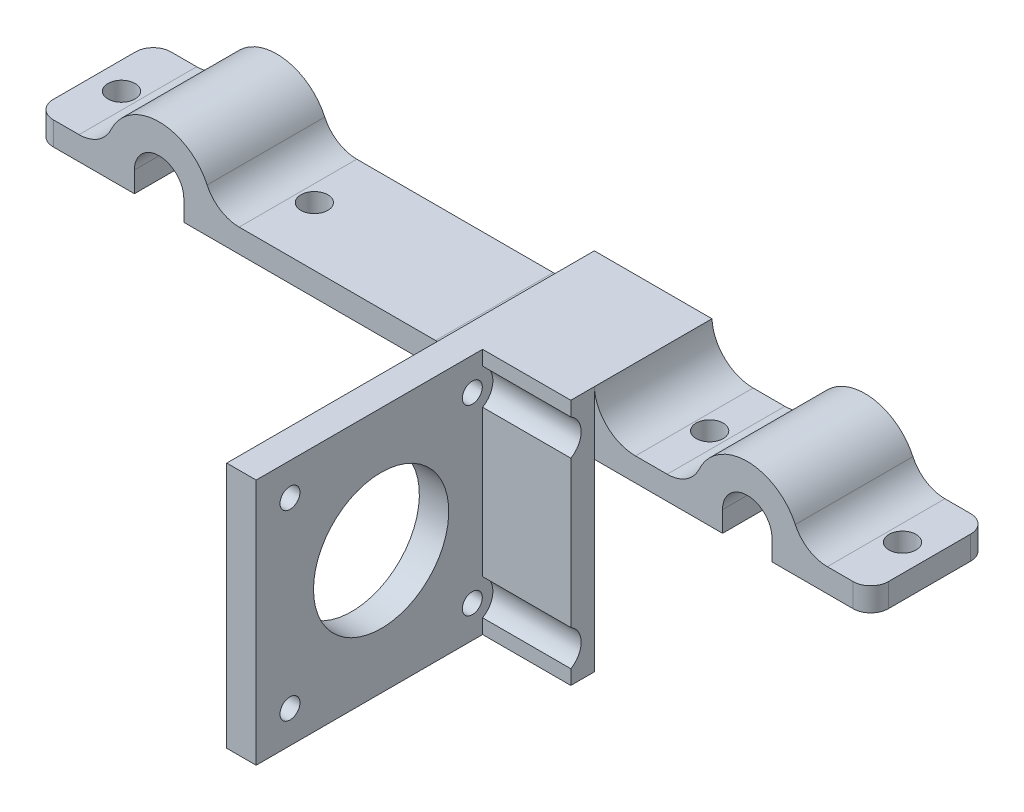
from build123d import *

# Parameters (mm, degrees)
EXTRUDE_1_DEPTH          = 20
FILLET_1_R               = 3
CUT_EXTRUDE_1_DEPTH      = 75.269642706
CUT_EXTRUDE_1_DEPTH_BACK = 75.269642706
SKETCH_2_R               = 2.3
SKETCH_3_W               = 20
SKETCH_3_H               = 35.3
EXTRUDE_2_DEPTH          = 4
SKETCH_4_W               = 5
SKETCH_4_H               = 42
EXTRUDE_3_DEPTH          = 38.5
EXTRUDE_4_DEPTH          = 6.7
CUT_EXTRUDE_2_REACH      = 119.861
SKETCH_6_R               = 11.5
SKETCH_6_R_2             = 1.7
FILLET_2_R               = 7
CUT_EXTRUDE_3_REACH      = 108.144
SKETCH_9_R               = 3.5
SKETCH_10_W              = 11.60500139
SKETCH_10_H              = 6
EXTRUDE_6_DEPTH          = 5


with BuildPart() as part:
    # 草图1 → 凸台-拉伸1 (new body)
    with BuildSketch(Plane.XY):
        with BuildLine():
            Line((54.2, 3.8), (54.2, 0.3))
            Line((54.2, 0.3), (70.99499861, 0.3))
            Line((70.99499861, 0.3), (70.99499861, 4.3))
            Line((70.99499861, 4.3), (63.612861565, 4.3))
            ThreePointArc((63.612861565, 4.3), (60.381762681, 5.244310136), (58.167716939, 7.78))
            ThreePointArc((58.167716939, 7.78), (50, 13), (41.832283061, 7.78))
            ThreePointArc((41.832283061, 7.78), (39.618237319, 5.244310136), (36.387138435, 4.3))
            Line((36.387138435, 4.3), (-36.387138435, 4.3))
            ThreePointArc((-36.387138435, 4.3), (-39.618237319, 5.244310136), (-41.832283061, 7.78))
            ThreePointArc((-41.832283061, 7.78), (-50, 13), (-58.167716939, 7.78))
            ThreePointArc((-58.167716939, 7.78), (-60.381762681, 5.244310136), (-63.612861565, 4.3))
            Line((-63.612861565, 4.3), (-70.99499861, 4.3))
            Line((-70.99499861, 4.3), (-70.99499861, 0.3))
            Line((-70.99499861, 0.3), (-54.2, 0.3))
            Line((-54.2, 0.3), (-54.2, 3.8))
            ThreePointArc((-54.2, 3.8), (-50, 8), (-45.8, 3.8))
            Line((-45.8, 3.8), (-45.8, 0.3))
            Line((-45.8, 0.3), (45.8, 0.3))
            Line((45.8, 0.3), (45.8, 3.8))
            ThreePointArc((45.8, 3.8), (50, 8), (54.2, 3.8))
        make_face()
    extrude(amount=EXTRUDE_1_DEPTH)

    # 圆角1
    fillet_1_edges = [part.edges().sort_by_distance(p)[0] for p in [
        (70.99499861, 2.3, 20),
        (-70.99499861, 2.3, 0),
        (70.99499861, 2.3, 0),
        (-70.99499861, 2.3, 20),
    ]]
    fillet(fillet_1_edges, radius=FILLET_1_R)

    # 草图2 → 切除-拉伸1 (cut, two sides: drawn at the far end of the back side and taken through both)
    with BuildSketch(Plane(origin=(0, 4.3, 0), x_dir=(1, 0, 0), z_dir=(0, 1, 0)).offset(-CUT_EXTRUDE_1_DEPTH_BACK)):
        with Locations(Location((66.39499861, -10, 0), (0, 0, 270))):
            Circle(SKETCH_2_R)
        with Locations(Location((33.60500139, -10, 0), (0, 0, 90))):
            Circle(SKETCH_2_R)
        with Locations(Location((-33.60500139, -10, 0), (0, 0, 270))):
            Circle(SKETCH_2_R)
        with Locations((-66.39499861, -10)):
            Circle(SKETCH_2_R)
    extrude(amount=CUT_EXTRUDE_1_DEPTH + CUT_EXTRUDE_1_DEPTH_BACK, mode=Mode.SUBTRACT)

    # 草图3 → 凸台-拉伸2 (add)
    with BuildSketch(Plane.XY.offset(20)):
        with Locations((14, -13.35)):
            Rectangle(SKETCH_3_W, SKETCH_3_H)
    extrude(amount=EXTRUDE_2_DEPTH)

    # 草图4 → 凸台-拉伸3 (add)
    with BuildSketch(Plane.XY.offset(24)):
        with Locations((6.5, -10)):
            Rectangle(SKETCH_4_W, SKETCH_4_H)
    extrude(amount=EXTRUDE_3_DEPTH)

    # 草图5 → 凸台-拉伸4 (add)
    with BuildSketch(Plane(origin=(0, 4.3, 0), x_dir=(1, 0, 0), z_dir=(0, 1, 0))):
        Polygon((4, -13), (4, -24), (24, -24), (24, 0), (4, 0), align=None)
    extrude(amount=EXTRUDE_4_DEPTH)

    # 草图6 → 切除-拉伸2 (cut, up to next)
    with BuildSketch(Plane(origin=(24, 0, 0), x_dir=(0, 0, -1), z_dir=(1, 0, 0)), mode=Mode.PRIVATE) as cut_extrude_2_sk1:
        with Locations(Location((-41.25, -10, 0), (0, 0, 90))):
            Circle(SKETCH_6_R)
    cut_extrude_2_tool1 = extrude(cut_extrude_2_sk1.sketch, amount=-CUT_EXTRUDE_2_REACH, mode=Mode.PRIVATE) & part.part
    # 草图6 → 切除-拉伸2 (cut, up to next)
    with BuildSketch(Plane(origin=(24, 0, 0), x_dir=(0, 0, -1), z_dir=(1, 0, 0)), mode=Mode.PRIVATE) as cut_extrude_2_sk2:
        with Locations(Location((-25.75, 5.5, 0), (0, 0, 90))):
            Circle(SKETCH_6_R_2)
    cut_extrude_2_tool2 = extrude(cut_extrude_2_sk2.sketch, amount=-CUT_EXTRUDE_2_REACH, mode=Mode.PRIVATE) & part.part
    # 草图6 → 切除-拉伸2 (cut, up to next)
    with BuildSketch(Plane(origin=(24, 0, 0), x_dir=(0, 0, -1), z_dir=(1, 0, 0)), mode=Mode.PRIVATE) as cut_extrude_2_sk3:
        with Locations(Location((-25.75, -25.5, 0), (0, 0, 90))):
            Circle(SKETCH_6_R_2)
    cut_extrude_2_tool3 = extrude(cut_extrude_2_sk3.sketch, amount=-CUT_EXTRUDE_2_REACH, mode=Mode.PRIVATE) & part.part
    # 草图6 → 切除-拉伸2 (cut, up to next)
    with BuildSketch(Plane(origin=(24, 0, 0), x_dir=(0, 0, -1), z_dir=(1, 0, 0)), mode=Mode.PRIVATE) as cut_extrude_2_sk4:
        with Locations(Location((-56.75, -25.5, 0), (0, 0, 90))):
            Circle(SKETCH_6_R_2)
    cut_extrude_2_tool4 = extrude(cut_extrude_2_sk4.sketch, amount=-CUT_EXTRUDE_2_REACH, mode=Mode.PRIVATE) & part.part
    # 草图6 → 切除-拉伸2 (cut, up to next)
    with BuildSketch(Plane(origin=(24, 0, 0), x_dir=(0, 0, -1), z_dir=(1, 0, 0)), mode=Mode.PRIVATE) as cut_extrude_2_sk5:
        with Locations(Location((-56.75, 5.5, 0), (0, 0, 90))):
            Circle(SKETCH_6_R_2)
    cut_extrude_2_tool5 = extrude(cut_extrude_2_sk5.sketch, amount=-CUT_EXTRUDE_2_REACH, mode=Mode.PRIVATE) & part.part
    add(cut_extrude_2_tool1.solids().sort_by_distance((24, -10, 41.25))[0], mode=Mode.SUBTRACT)
    add(cut_extrude_2_tool2.solids().sort_by_distance((24, 5.5, 25.75))[0], mode=Mode.SUBTRACT)
    add(cut_extrude_2_tool3.solids().sort_by_distance((24, -25.5, 25.75))[0], mode=Mode.SUBTRACT)
    add(cut_extrude_2_tool4.solids().sort_by_distance((24, -25.5, 56.75))[0], mode=Mode.SUBTRACT)
    add(cut_extrude_2_tool5.solids().sort_by_distance((24, 5.5, 56.75))[0], mode=Mode.SUBTRACT)

    # 圆角2
    # the kernel refuses this fillet: 7 mm, written as the material it adds along each edge
    with BuildSketch(Plane(origin=(4, 4.3, 0), x_dir=(0, 1, 0), z_dir=(0, 0, 1))) as fillet_2_piece_1:
        with BuildLine():
            CenterArc((7, 6.993568474), FILLET_2_R, 180, 87.543714276)
            Line((0, 6.993568474), (-0.14, 6.993568474))
            Line((-0.14, 6.993568474), (-0.14, 0))
            Line((-0.14, 0), (0, -0.14))
            ThreePointArc((0, -0.14), (3.35, -0.14), (6.694, -0.139871369))
            Line((6.694, -0.139871369), (6.7, 0))
        make_face()
    extrude(amount=20)
    with BuildSketch(Plane(origin=(24, 4.3, 20), x_dir=(1, 0, 0), z_dir=(0, 0, -1))) as fillet_2_piece_2:
        with BuildLine():
            CenterArc((6.993568474, -7), FILLET_2_R, 90, 87.543714276)
            Line((0, -6.7), (-0.139871369, -6.694))
            ThreePointArc((-0.139871369, -6.694), (-0.14, -3.35), (-0.14, 0))
            Line((-0.14, 0), (0, 0.14))
            Line((0, 0.14), (6.993568474, 0.14))
            Line((6.993568474, 0.14), (6.993568474, 0))
        make_face()
    extrude(amount=20)

    # 草图9 → 切除-拉伸3 (cut, up to next)
    with BuildSketch(Plane(origin=(9, 0, 0), x_dir=(0, 0, -1), z_dir=(1, 0, 0)), mode=Mode.PRIVATE) as cut_extrude_3_sk1:
        with Locations((-25.75, 5.5)):
            Circle(SKETCH_9_R)
    cut_extrude_3_tool1 = extrude(cut_extrude_3_sk1.sketch, amount=CUT_EXTRUDE_3_REACH, mode=Mode.PRIVATE) & part.part
    # 草图9 → 切除-拉伸3 (cut, up to next)
    with BuildSketch(Plane(origin=(9, 0, 0), x_dir=(0, 0, -1), z_dir=(1, 0, 0)), mode=Mode.PRIVATE) as cut_extrude_3_sk2:
        with Locations((-25.75, -25.5)):
            Circle(SKETCH_9_R)
    cut_extrude_3_tool2 = extrude(cut_extrude_3_sk2.sketch, amount=CUT_EXTRUDE_3_REACH, mode=Mode.PRIVATE) & part.part
    add(cut_extrude_3_tool1.solids().sort_by_distance((9, 5.5, 25.75))[0], mode=Mode.SUBTRACT)
    add(cut_extrude_3_tool2.solids().sort_by_distance((9, -25.5, 25.75))[0], mode=Mode.SUBTRACT)

    # 草图10 → 凸台-拉伸6 (add)
    with BuildSketch(Plane.XZ.offset(-0.3)):
        with Locations((17.802500695, 10)):
            Rectangle(SKETCH_10_W, SKETCH_10_H)
        with Locations((-17.802500695, 10)):
            Rectangle(SKETCH_10_W, SKETCH_10_H)
    extrude(amount=EXTRUDE_6_DEPTH)


solid = part.part
